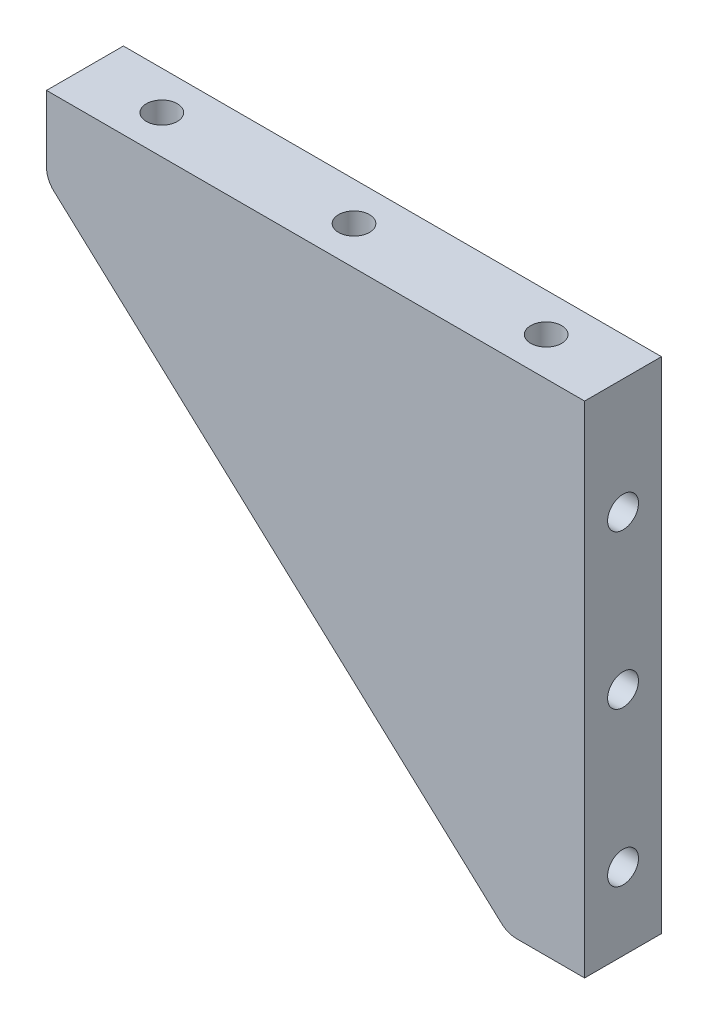
from build123d import *

# Parameters (mm, degrees)
BOSS_EXTRUDE1_DEPTH = 6.35
LPATTERN1_COUNT     = 3
LPATTERN1_PITCH     = 31.75
LPATTERN2_COUNT     = 3
LPATTERN2_PITCH     = 25.4
FILLET1_R           = 3.81


with BuildPart() as part:
    # Sketch1 → Boss-Extrude1 (new, symmetric)
    with BuildSketch(Plane.XY):
        Polygon((0, 0), (-88.9, 0), (-88.9, -12.7), (-12.7, -82.55), (0, -82.55), align=None)
    extrude(amount=BOSS_EXTRUDE1_DEPTH, both=True)

    # Sketch3 → Tap Drill for 1/4-20 Tap1 (revolve, cut)
    with BuildSketch(Plane(origin=(-76.2, 0, 0), x_dir=(0, 0, 1), z_dir=(1, 0, 0))):
        Polygon((0, 0), (0, 14.233816902), (2.5527, 12.7), (2.5527, 0), align=None)
    tap_drill_for_1_4_20_tap1 = revolve(axis=Axis((-76.2, 6.35, 0), (0, -1, 0)), mode=Mode.SUBTRACT)

    # LPattern1: Tap Drill for 1/4-20 Tap1 ×3
    with Locations(*[(i * LPATTERN1_PITCH, 0, 0) for i in range(1, LPATTERN1_COUNT)]):
        add(tap_drill_for_1_4_20_tap1, mode=Mode.SUBTRACT)

    # Sketch5 → Tap Drill for 1/4-20 Tap2 (revolve, cut)
    with BuildSketch(Plane(origin=(0, -69.85, 0), x_dir=(0, 0, -1), z_dir=(0, 1, 0))):
        Polygon((0, 0), (0, 14.233816902), (2.5527, 12.7), (2.5527, 0), align=None)
    tap_drill_for_1_4_20_tap2 = revolve(axis=Axis((6.35, -69.85, 0), (-1, 0, 0)), mode=Mode.SUBTRACT)

    # LPattern2: Tap Drill for 1/4-20 Tap2 ×3
    with Locations(*[(0, i * LPATTERN2_PITCH, 0) for i in range(1, LPATTERN2_COUNT)]):
        add(tap_drill_for_1_4_20_tap2, mode=Mode.SUBTRACT)

    # Fillet1
    fillet1_edges = [part.edges().sort_by_distance(p)[0] for p in [
        (-88.9, -12.7, 0),
        (-12.7, -82.55, 0),
    ]]
    fillet(fillet1_edges, radius=FILLET1_R)


solid = part.part
